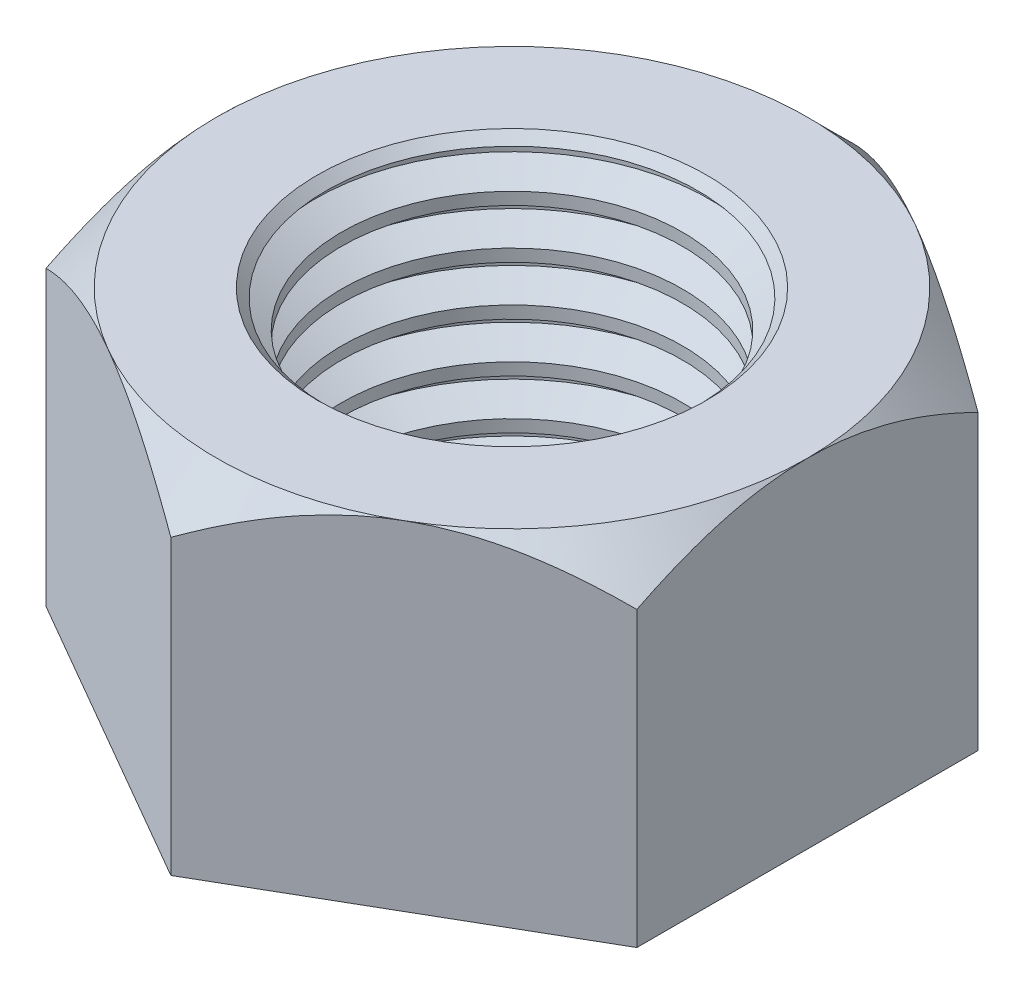
from build123d import *

# Parameters (mm, degrees)
EXTRUDE1_DEPTH  = 21.828125
LPATTERN2_COUNT = 7
LPATTERN2_PITCH = 3.175
CHAMFER1_SIZE   = 1.5875
CHAMFER1_SIZE_2 = 1.162130657


with BuildPart() as part:
    # Sketch1 → Extrude1 (new body)
    with BuildSketch(Plane(origin=(0, 0, 0), x_dir=(1, 0, 0), z_dir=(0, 1, 0))):
        Polygon((0, 21.997045256), (-19.05, 10.998522628), (-19.05, -10.998522628), (0, -21.997045256), (19.05, -10.998522628), (19.05, 10.998522628), align=None)
    extrude(amount=EXTRUDE1_DEPTH)

    # Sketch3 → Cut-Revolve2 (revolve, cut)
    with BuildSketch(Plane(origin=(0, 0, 0), x_dir=(0, 0, -1), z_dir=(1, 0, 0))):
        Polygon((19.05, 21.828125), (21.997045256, 18.881079744), (21.997045256, 21.828125), align=None)
    revolve(axis=Axis((0, 0.541995889, 0), (0, -1, 0)), mode=Mode.SUBTRACT)

    # Sketch2 → Cut-Revolve1 (revolve, cut)
    with BuildSketch(Plane.XY, mode=Mode.PRIVATE) as cut_revolve1_sk:
        Polygon((0, 21.828125), (10.981480839, 21.828125), (12.7, 20.8359375), (12.7, 20.4390625), (10.981480839, 19.446875), (10.981480839, 18.653125), (0, 18.653125), align=None)
    cut_revolve1 = revolve(cut_revolve1_sk.sketch.rotate(Axis((0, 1.663578541, 0), (0, -1, 0)), 90), axis=Axis((0, 1.663578541, 0), (0, -1, 0)), mode=Mode.SUBTRACT)

    # LPattern2: Cut-Revolve1 ×7
    with Locations(*[(0, -i * LPATTERN2_PITCH, 0) for i in range(1, LPATTERN2_COUNT)]):
        add(cut_revolve1, mode=Mode.SUBTRACT)

    # Chamfer1
    # the kernel refuses this chamfer: 1.5875, 1.162130657 mm, written as the material it takes off along each edge
    with BuildSketch(Plane(origin=(0, 21.828125, 0), x_dir=(0, 0, 1), z_dir=(1, 0, 0))) as chamfer1_piece_1:
        Polygon((10.981480839 + CHAMFER1_SIZE, 0), (10.981480839 + CHAMFER1_SIZE_2 * 0.866025403796, CHAMFER1_SIZE_2 * 0.500000000007), (10.981480839, 0), align=None)
    revolve(axis=Axis((0, 21.828125, 0), (0, -1, 0)), mode=Mode.SUBTRACT)


solid = part.part
